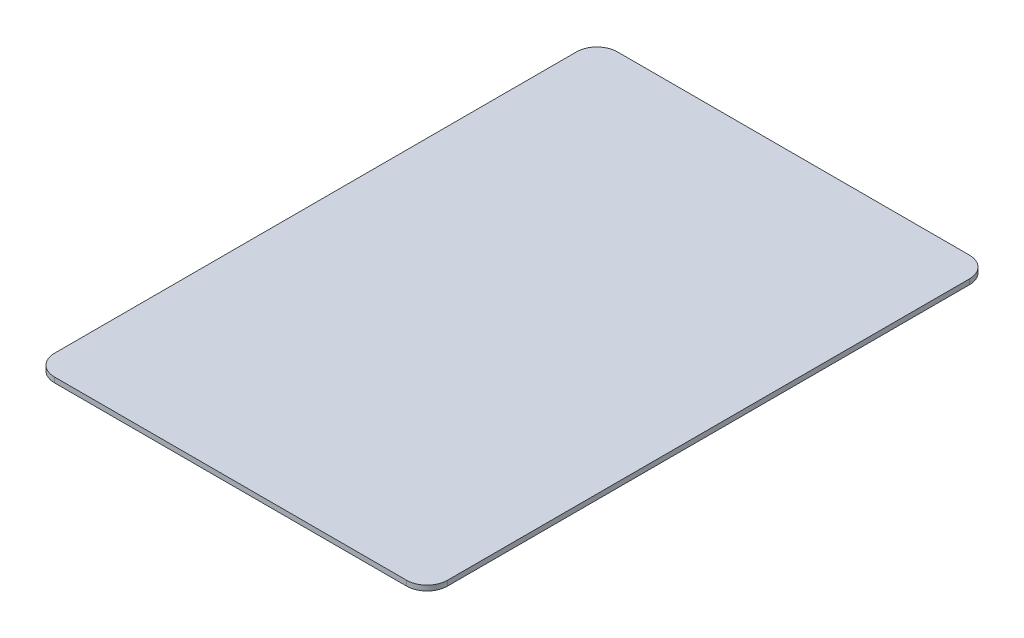
from build123d import *

# Parameters (mm, degrees)
BOSS_EXTRUDE1_DEPTH = 0.5


with BuildPart() as part:
    # Sketch3 → Boss-Extrude1 (new body)
    with BuildSketch(Plane(origin=(0, 0, 0), x_dir=(1, 0, 0), z_dir=(0, 1, 0))):
        with BuildLine():
            Line((-17.2, -27.5), (17.2, -27.5))
            ThreePointArc((17.2, -27.5), (18.614213562, -26.914213562), (19.2, -25.5))
            Line((19.2, -25.5), (19.2, 25.5))
            ThreePointArc((19.2, 25.5), (18.614213562, 26.914213562), (17.2, 27.5))
            Line((17.2, 27.5), (-17.2, 27.5))
            ThreePointArc((-17.2, 27.5), (-18.614213562, 26.914213562), (-19.2, 25.5))
            Line((-19.2, 25.5), (-19.2, -25.5))
            ThreePointArc((-19.2, -25.5), (-18.614213562, -26.914213562), (-17.2, -27.5))
        make_face()
    extrude(amount=BOSS_EXTRUDE1_DEPTH)


solid = part.part
